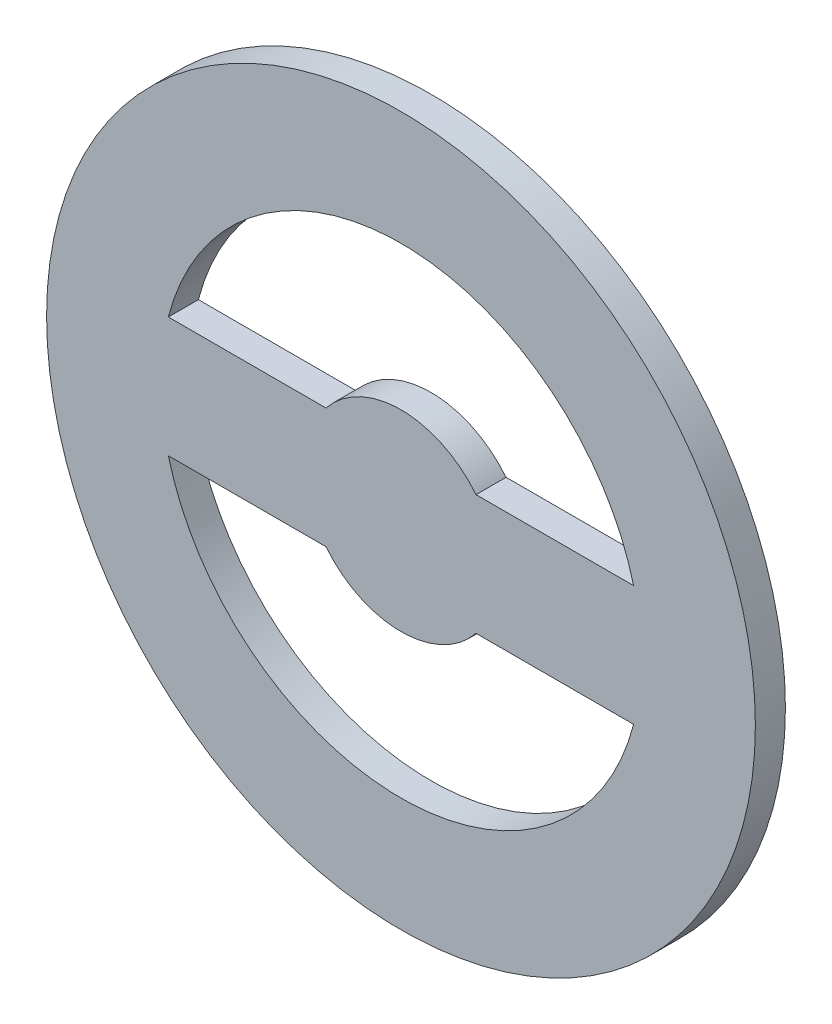
from build123d import *

# Parameters (mm, degrees)
SKETCH1_R           = 37.465
BOSS_EXTRUDE1_DEPTH = 3.175
CUT_EXTRUDE1_DEPTH  = 54.078555698


with BuildPart() as part:
    # Sketch1 → Boss-Extrude1 (new body)
    with BuildSketch(Plane.XY):
        Circle(SKETCH1_R)
    extrude(amount=BOSS_EXTRUDE1_DEPTH)

    # Sketch2 → Cut-Extrude1 (cut, through all)
    with BuildSketch(Plane.XY.offset(3.175)):
        with BuildLine():
            Line((-24.593444248, -6.35), (-7.931147458, -6.35))
            ThreePointArc((-7.931147458, -6.35), (0, -10.16), (7.931147458, -6.35))
            Line((7.931147458, -6.35), (24.593444248, -6.35))
            ThreePointArc((24.593444248, -6.35), (0, -25.4), (-24.593444248, -6.35))
        make_face()
        with BuildLine():
            Line((7.931147458, 6.35), (24.593444248, 6.35))
            ThreePointArc((24.593444248, 6.35), (0, 25.4), (-24.593444248, 6.35))
            Line((-24.593444248, 6.35), (-7.931147458, 6.35))
            ThreePointArc((-7.931147458, 6.35), (0, 10.16), (7.931147458, 6.35))
        make_face()
    extrude(amount=-CUT_EXTRUDE1_DEPTH, mode=Mode.SUBTRACT)


solid = part.part
